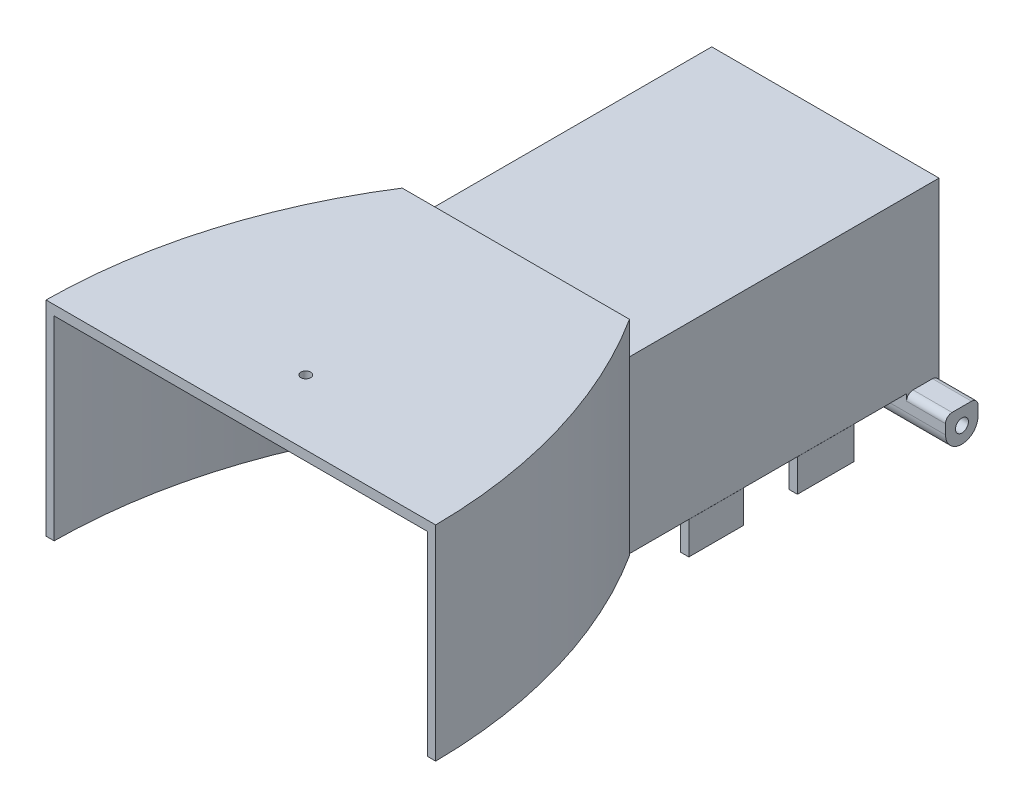
from build123d import *

# Parameters (mm, degrees)
SKETCH_1_W                = 70
SKETCH_1_H                = 70
EXTRUDE_1_DEPTH           = 180
SKETCH_3_W                = 65
SKETCH_3_H                = 65
CUT_EXTRUDE_1_DEPTH       = 173
SKETCH_4_R                = 10.95
CUT_EXTRUDE_2_DEPTH       = 137
SKETCH_5_W                = 50
SKETCH_5_H                = 55
CUT_EXTRUDE_3_DEPTH       = 137
SKETCH_6_W                = 35
SKETCH_6_H                = 10
EXTRUDE_2_DEPTH           = 18
CUT_EXTRUDE_4_DEPTH       = 200.321348581
CUT_EXTRUDE_4_DEPTH_BACK  = 200.321348581
SKETCH_7_W                = 70
SKETCH_7_H                = 20
SKETCH_9_W                = 70
SKETCH_9_H                = 180
EXTRUDE_3_DEPTH           = 2.5
EXTRUDE_4_DEPTH           = 10
EXTRUDE_4_DEPTH_BACK      = 53
CUT_EXTRUDE_7_DEPTH       = 60
SKETCH_18_W               = 65
SKETCH_18_H               = 47.5
CUT_EXTRUDE_12_DEPTH      = 105
CUT_EXTRUDE_13_DEPTH      = 105
CUT_EXTRUDE_13_DEPTH_BACK = 2.5
SKETCH_20_W               = 65
SKETCH_20_H               = 125.518576077
SKETCH_21_R               = 1.5
CUT_EXTRUDE_14_DEPTH      = 10
SKETCH_23_W               = 94
SKETCH_23_H               = 10
EXTRUDE_5_DEPTH           = 10
SKETCH_24_R               = 2
CUT_EXTRUDE_15_DEPTH      = 194
FILLET_1_R                = 2
FILLET_2_R                = 2
FILLET_3_R                = 2
FILLET_4_R                = 5
SKETCH_25_W               = 2.52996266
SKETCH_25_H               = 16.78546259
SKETCH_25_H_2             = 17.490734126
SKETCH_25_W_2             = 2.5
SKETCH_25_H_3             = 17.349679819
EXTRUDE_6_DEPTH           = 10


with BuildPart() as part:
    # 스케치1 → 보스-돌출1 (new body)
    with BuildSketch(Plane.XY):
        with Locations((35, -35)):
            Rectangle(SKETCH_1_W, SKETCH_1_H)
    extrude(amount=EXTRUDE_1_DEPTH)

    # 스케치3 → 컷-돌출1 (cut)
    with BuildSketch(Plane.XY.offset(180)):
        with Locations((35, -35)):
            Rectangle(SKETCH_3_W, SKETCH_3_H)
    extrude(amount=-CUT_EXTRUDE_1_DEPTH, mode=Mode.SUBTRACT)

    # 스케치4 → 컷-돌출2 (cut)
    with BuildSketch(Plane(origin=(0, 0, 0), x_dir=(-1, 0, 0), z_dir=(0, 0, -1))):
        with Locations((-35, -35)):
            Circle(SKETCH_4_R)
    extrude(amount=-CUT_EXTRUDE_2_DEPTH, mode=Mode.SUBTRACT)

    # 스케치5 → 컷-돌출3 (cut)
    with BuildSketch(Plane(origin=(70, 0, 0), x_dir=(0, 0, -1), z_dir=(1, 0, 0))):
        with Locations((-155, -35)):
            Rectangle(SKETCH_5_W, SKETCH_5_H)
    extrude(amount=-CUT_EXTRUDE_3_DEPTH, mode=Mode.SUBTRACT)

    # 스케치6 → 보스-돌출2 (add)
    with BuildSketch(Plane.ZY):
        with Locations((37.5, -25)):
            Rectangle(SKETCH_6_W, SKETCH_6_H)
        with Locations((37.5, -45)):
            Rectangle(SKETCH_6_W, SKETCH_6_H)
    extrude_2 = extrude(amount=-EXTRUDE_2_DEPTH)

    # 대칭 복사1: 보스-돌출2 across plane
    add(extrude_2.mirror(Plane(origin=(35, 0, 0), x_dir=(0, 0, 1), z_dir=(1, 0, 0))))

    # 스케치7 → 컷-돌출4 (cut, two sides: drawn at the far end of the back side and taken through both)
    with BuildSketch(Plane.XY.offset(7).offset(-CUT_EXTRUDE_4_DEPTH_BACK)):
        with Locations((35, -60)):
            Rectangle(SKETCH_7_W, SKETCH_7_H)
    extrude(amount=CUT_EXTRUDE_4_DEPTH + CUT_EXTRUDE_4_DEPTH_BACK, mode=Mode.SUBTRACT)

    # 스케치9 → 보스-돌출3 (add)
    with BuildSketch(Plane.XZ.offset(50)):
        with Locations((35, 90)):
            Rectangle(SKETCH_9_W, SKETCH_9_H)
    extrude(amount=EXTRUDE_3_DEPTH)

    # 스케치11 → 보스-돌출4 (add, two sides: drawn at the far end of the back side and taken through both)
    with BuildSketch(Plane(origin=(0, 0, 0), x_dir=(1, 0, 0), z_dir=(0, 1, 0)).offset(-EXTRUDE_4_DEPTH_BACK)):
        with BuildLine():
            Line((0, -95.320459485), (70, -95.320459485))
            ThreePointArc((70, -95.320459485), (88.456704779, -135.901627622), (95, -180))
            Line((95, -180), (-25, -180))
            ThreePointArc((-25, -180), (-18.456704779, -135.901627622), (0, -95.320459485))
        make_face()
    extrude(amount=EXTRUDE_4_DEPTH + EXTRUDE_4_DEPTH_BACK)

    # 스케치13 → 컷-돌출7 (cut)
    with BuildSketch(Plane.XZ.offset(53)):
        with BuildLine():
            Line((-22.5, 180), (92.5, 180))
            ThreePointArc((92.5, 180), (86.367270586, 137.316234441), (69.058371922, 97.820459485))
            Line((69.058371922, 97.820459485), (0.941628078, 97.820459485))
            ThreePointArc((0.941628078, 97.820459485), (-16.367270586, 137.316234441), (-22.5, 180))
        make_face()
    extrude(amount=-CUT_EXTRUDE_7_DEPTH, mode=Mode.SUBTRACT)

    # 스케치18 → 컷-돌출12 (cut)
    with BuildSketch(Plane(origin=(0, 0, 95.320459485), x_dir=(-1, 0, 0), z_dir=(0, 0, -1))):
        with Locations((-35, -26.25)):
            Rectangle(SKETCH_18_W, SKETCH_18_H)
    extrude(amount=-CUT_EXTRUDE_12_DEPTH, mode=Mode.SUBTRACT)

    # 스케치20 → 컷-돌출13 (cut, two sides: drawn at the far end of the back side and taken through both)
    with BuildSketch(Plane.XZ.offset(52.5).offset(-CUT_EXTRUDE_13_DEPTH_BACK)):
        with Locations((35, 69.759288039)):
            Rectangle(SKETCH_20_W, SKETCH_20_H)
    extrude(amount=CUT_EXTRUDE_13_DEPTH + CUT_EXTRUDE_13_DEPTH_BACK, mode=Mode.SUBTRACT)

    # 스케치21 → 컷-돌출14 (cut)
    with BuildSketch(Plane(origin=(0, 10, 0), x_dir=(1, 0, 0), z_dir=(0, 1, 0))):
        with Locations(Location((35, -160, 0), (0, 0, 270))):
            Circle(SKETCH_21_R)
    extrude(amount=-CUT_EXTRUDE_14_DEPTH, mode=Mode.SUBTRACT)

    # 스케치23 → 보스-돌출5 (add)
    with BuildSketch(Plane.XZ.offset(52.5)):
        with Locations((35, 5)):
            Rectangle(SKETCH_23_W, SKETCH_23_H)
    extrude(amount=EXTRUDE_5_DEPTH)

    # 스케치24 → 컷-돌출15 (cut)
    with BuildSketch(Plane.ZY.offset(12)):
        with Locations((4.937361109, -57.5)):
            Circle(SKETCH_24_R)
    extrude(amount=-CUT_EXTRUDE_15_DEPTH, mode=Mode.SUBTRACT)

    # 필렛1
    fillet_1_edges = [part.edges().sort_by_distance(p)[0] for p in [
        (35, -52.5, 10),
    ]]
    fillet(fillet_1_edges, radius=FILLET_1_R)

    # 필렛2
    fillet_2_edges = [part.edges().sort_by_distance(p)[0] for p in [
        (76, -52.5, 10),
        (-6, -52.5, 10),
    ]]
    fillet(fillet_2_edges, radius=FILLET_2_R)

    # 필렛3
    fillet_3_edges = [part.edges().sort_by_distance(p)[0] for p in [
        (-6, -52.5, 0),
        (76, -52.5, 0),
    ]]
    fillet(fillet_3_edges, radius=FILLET_3_R)

    # 필렛4
    fillet_4_edges = [part.edges().sort_by_distance(p)[0] for p in [
        (35, -62.5, 10),
        (35, -62.5, 0),
    ]]
    fillet(fillet_4_edges, radius=FILLET_4_R - 0.0001)  # a hair under: the kernel refuses the full size

    # 스케치25 → 보스-돌출6 (add)
    with BuildSketch(Plane.XZ.offset(52.5)):
        with Locations((68.76498133, 68.677635779)):
            Rectangle(SKETCH_25_W, SKETCH_25_H)
        with Locations((68.76498133, 34.895129139)):
            Rectangle(SKETCH_25_W, SKETCH_25_H_2)
        with Locations((1.25, 68.677635779)):
            Rectangle(SKETCH_25_W_2, SKETCH_25_H)
        with Locations((1.25, 34.965656293)):
            Rectangle(SKETCH_25_W_2, SKETCH_25_H_3)
    extrude(amount=EXTRUDE_6_DEPTH)


solid = part.part
